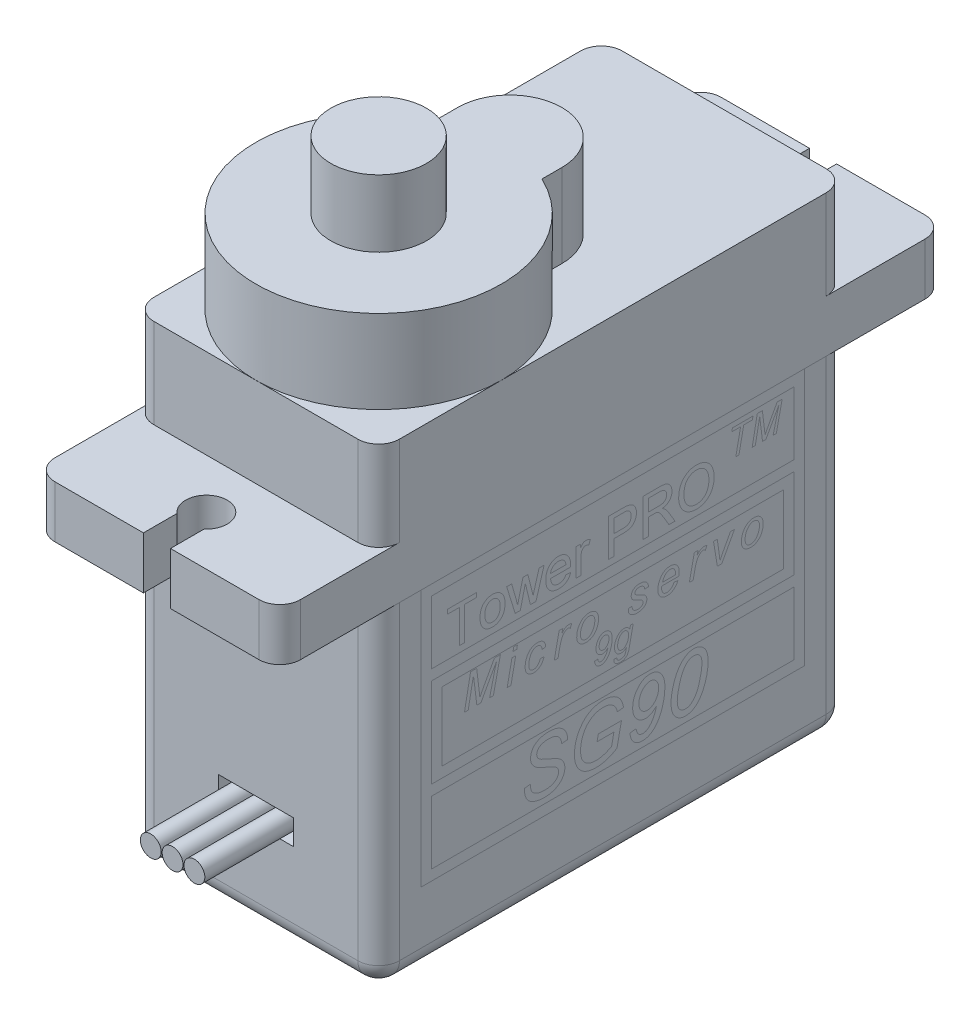
from build123d import *

# Parameters (mm, degrees)
EXTRUDE_1_DEPTH                = 5.9
EXTRUDE_2_DEPTH                = 4
SKETCH_3_R                     = 2.3
EXTRUDE_3_DEPTH                = 3.22
SKETCH_4_W                     = 3.6
SKETCH_4_H                     = 1.2
CUT_EXTRUDE_1_DEPTH            = 1
CUT_EXTRUDE_2_DEPTH            = 26.087247757
FILLET_1_R                     = 1
EXTRUDE_5_DEPTH                = 5
SPLIT_BODIES_1_SURFACE_1_BACK  = 46.37
SPLIT_BODIES_1_SURFACE_1_DEPTH = 92.74
SPLIT_BODIES_1_SURFACE_2_BACK  = 46.37
SPLIT_BODIES_1_SURFACE_2_DEPTH = 92.74
SKETCH_13_W                    = 18.412945036
SKETCH_13_H                    = 12.358306079
CUT_EXTRUDE_3_DEPTH            = 15
SPLIT_START                    = -11.25
SPLIT_BODIES_2_OUTLINE_R       = 0.5
SPLIT_BODIES_2_DEPTH           = 26.5
SPLIT_START_2                  = 9.206472518
SPLIT_BODIES_2_2_OUTLINE_W     = 11.8
SPLIT_BODIES_2_2_OUTLINE_H     = 12.358306079
SPLIT_BODIES_2_2_OUTLINE_R     = 0.5
SPLIT_BODIES_2_2_DEPTH         = 6.043527482
SPLIT_BODIES_2_3_OUTLINE_W     = 11.8
SPLIT_BODIES_2_3_OUTLINE_H     = 12.358306079
SPLIT_BODIES_2_3_OUTLINE_R     = 0.5
SPLIT_BODIES_2_3_DEPTH         = 2.043527482
SPLIT_START_3                  = -10.25
SPLIT_BODIES_2_4_DEPTH         = 20.5
SPLIT_BODIES_2_5_OUTLINE_W     = 11.8
SPLIT_BODIES_2_5_OUTLINE_H     = 12.358306079
SPLIT_BODIES_2_5_DEPTH         = 1.043527482
SPLIT_BODIES_2_6_OUTLINE_W     = 11.8
SPLIT_BODIES_2_6_OUTLINE_H     = 12.358306079
SPLIT_BODIES_2_6_DEPTH         = 1.043527482
SPLIT_START_4                  = 10.25
SPLIT_BODIES_2_7_OUTLINE_R     = 0.5
SPLIT_BODIES_2_7_DEPTH         = 5
SPLIT_BODIES_2_8_OUTLINE_W     = 3.6
SPLIT_BODIES_2_8_OUTLINE_H     = 1.2
SPLIT_BODIES_2_8_DEPTH         = 2.043527482
SPLIT_START_5                  = -10.35
SPLIT_BODIES_2_9_DEPTH         = 14.9
SPLIT_START_6                  = -5.95
SPLIT_BODIES_2_10_OUTLINE_W    = 3.6
SPLIT_BODIES_2_10_OUTLINE_H    = 1
SPLIT_BODIES_2_10_DEPTH        = 10.5
SPLIT_BODIES_2_11_OUTLINE_W    = 3.6
SPLIT_BODIES_2_11_OUTLINE_H    = 1
SPLIT_BODIES_2_11_DEPTH        = 3.2
PATTERN_CIRCULAR_2_ANGLE       = 180


with BuildPart() as part:
    # Эскиз1 → Бобышка-Вытянуть1 (new, symmetric)
    with BuildSketch(Plane(origin=(0, 0, 0), x_dir=(0, 0, -1), z_dir=(1, 0, 0))):
        Polygon((11.25, -11.35), (-11.25, -11.35), (-11.25, 4.55), (-16, 4.55), (-16, 7.05), (-11.25, 7.05), (-11.25, 11.35), (11.25, 11.35), (11.25, 7.05), (16, 7.05), (16, 4.55), (11.25, 4.55), align=None)
    extrude(amount=EXTRUDE_1_DEPTH, both=True)

    # Эскиз2 → Бобышка-Вытянуть2 (add)
    with BuildSketch(Plane(origin=(0, 11.35, 0), x_dir=(1, 0, 0), z_dir=(0, 1, 0))):
        with BuildLine():
            Line((-2.5, -0.005844314), (-2.5, 0.95))
            ThreePointArc((-2.5, 0.95), (0, 3.45), (2.5, 0.95))
            Line((2.5, 0.95), (2.5, -0.005844314))
            ThreePointArc((2.5, -0.005844314), (0, -11.25), (-2.5, -0.005844314))
        make_face()
    extrude(amount=EXTRUDE_2_DEPTH)

    # Эскиз3 → Бобышка-Вытянуть3 (add)
    with BuildSketch(Plane(origin=(0, 15.35, 0), x_dir=(1, 0, 0), z_dir=(0, 1, 0))):
        with Locations(Location((0, -5.35, 0), (0, 0, 90))):
            Circle(SKETCH_3_R)
    extrude(amount=EXTRUDE_3_DEPTH)

    # Эскиз4 → Вырез-Вытянуть1 (cut)
    with BuildSketch(Plane.XY.offset(11.25)):
        with Locations((0, -6.55)):
            Rectangle(SKETCH_4_W, SKETCH_4_H)
    extrude(amount=-CUT_EXTRUDE_1_DEPTH, mode=Mode.SUBTRACT)

    # Эскиз5 → Вырез-Вытянуть2 (cut, through all)
    with BuildSketch(Plane(origin=(0, 7.05, 0), x_dir=(1, 0, 0), z_dir=(0, 1, 0))):
        with BuildLine():
            Line((-0.65, -16), (0.65, -16))
            Line((0.65, -16), (0.65, -14.384934208))
            ThreePointArc((0.65, -14.384934208), (0, -12.625), (-0.65, -14.384934208))
            Line((-0.65, -14.384934208), (-0.65, -16))
        make_face()
        with BuildLine():
            Line((-0.65, 16), (-0.65, 14.384934208))
            ThreePointArc((-0.65, 14.384934208), (0, 12.625), (0.65, 14.384934208))
            Line((0.65, 14.384934208), (0.65, 16))
            Line((0.65, 16), (-0.65, 16))
        make_face()
    extrude(amount=-CUT_EXTRUDE_2_DEPTH, mode=Mode.SUBTRACT)

    # Скругление1
    fillet_1_edges = [part.edges().sort_by_distance(p)[0] for p in [
        (-5.9, 9.2, -11.25),
        (5.9, 5.8, 16),
        (-5.9, 5.8, -16),
        (-5.9, -3.4, -11.25),
        (-5.9, -11.35, 0),
        (-5.9, -3.4, 11.25),
        (-5.9, 5.8, 16),
        (-5.9, 9.2, 11.25),
        (5.9, -3.4, 11.25),
        (0, -11.35, -11.25),
        (0, -11.35, 11.25),
        (5.9, -11.35, 0),
        (5.9, -3.4, -11.25),
        (5.9, 5.8, -16),
        (5.9, 9.2, -11.25),
        (5.9, 9.2, 11.25),
    ]]
    fillet(fillet_1_edges, radius=FILLET_1_R)

    # Эскиз7 → Бобышка-Вытянуть5 (add)
    with BuildSketch(Plane.XY.offset(10.25)):
        with BuildLine():
            ThreePointArc((-1.55, -6.55), (-1.05, -7.05), (-0.55, -6.55))
            Line((-0.55, -6.55), (-1.55, -6.55))
        make_face()
        with BuildLine():
            Line((-1.55, -6.55), (-0.55, -6.55))
            ThreePointArc((-0.55, -6.55), (-1.05, -6.05), (-1.55, -6.55))
        make_face()
        with BuildLine():
            ThreePointArc((-0.5, -6.55), (0, -7.05), (0.5, -6.55))
            Line((0.5, -6.55), (-0.5, -6.55))
        make_face()
        with BuildLine():
            Line((-0.5, -6.55), (0.5, -6.55))
            ThreePointArc((0.5, -6.55), (0, -6.05), (-0.5, -6.55))
        make_face()
        with BuildLine():
            ThreePointArc((0.55, -6.55), (1.05, -7.05), (1.55, -6.55))
            Line((1.55, -6.55), (0.55, -6.55))
        make_face()
        with BuildLine():
            Line((0.55, -6.55), (1.55, -6.55))
            ThreePointArc((1.55, -6.55), (1.05, -6.05), (0.55, -6.55))
        make_face()
    extrude(amount=EXTRUDE_5_DEPTH)


with BuildPart() as body_2:
    # Split Bodies 1: the piece behind the surface
    add(part.part)
    # Split Bodies 1 surface: a surface, the sketch's curves swept straight by 92.74 mm
    with BuildLine(Plane(origin=(0, 0, 0), x_dir=(0, 0, -1), z_dir=(1, 0, 0)).offset(-SPLIT_BODIES_1_SURFACE_1_BACK), mode=Mode.PRIVATE) as split_bodies_1_surface_1_path:
        Line((-15, 4.55), (19.075279201, 4.55))
    split_bodies_1_surface_1 = Shell.extrude(split_bodies_1_surface_1_path.wire(), (1 * SPLIT_BODIES_1_SURFACE_1_DEPTH, 0 * SPLIT_BODIES_1_SURFACE_1_DEPTH, 0 * SPLIT_BODIES_1_SURFACE_1_DEPTH))
    split(bisect_by=split_bodies_1_surface_1, keep=Keep.BOTTOM)

    # Эскиз13 → Вырез-Вытянуть3 (cut)
    with BuildSketch(Plane(origin=(0, 0, 0), x_dir=(0, 0, -1), z_dir=(1, 0, 0))):
        with Locations((0, -1.629153039)):
            Rectangle(SKETCH_13_W, SKETCH_13_H)
    extrude(amount=-CUT_EXTRUDE_3_DEPTH, mode=Mode.SUBTRACT)

    # Split Bodies 2: read off the stored shape, not the designer's step
    # Split Bodies 2 outline → Split Bodies 2 (cut)
    with BuildSketch(Plane.XY.offset(SPLIT_START)):
        with BuildLine():
            Line((5.9, -10.35), (5.9, -7.808306079))
            Line((5.9, -7.808306079), (-5.9, -7.808306079))
            Line((-5.9, -7.808306079), (-5.9, -10.35))
            ThreePointArc((-5.9, -10.35), (-5.607106781, -11.057106781), (-4.9, -11.35))
            Line((-4.9, -11.35), (4.9, -11.35))
            ThreePointArc((4.9, -11.35), (5.607106781, -11.057106781), (5.9, -10.35))
        make_face()
        with Locations((-1.05, -6.55)):
            Circle(SPLIT_BODIES_2_OUTLINE_R)
    extrude(amount=SPLIT_BODIES_2_DEPTH, mode=Mode.SUBTRACT)

    # Split Bodies 2 2 outline → Split Bodies 2 2 (cut)
    with BuildSketch(Plane.XY.offset(SPLIT_START_2)):
        with Locations((0, -1.629153039)):
            Rectangle(SPLIT_BODIES_2_2_OUTLINE_W, SPLIT_BODIES_2_2_OUTLINE_H)
        with Locations((-1.05, -6.55)):
            Circle(SPLIT_BODIES_2_2_OUTLINE_R, mode=Mode.SUBTRACT)
    extrude(amount=SPLIT_BODIES_2_2_DEPTH, mode=Mode.SUBTRACT)

    # Split Bodies 2 3 outline → Split Bodies 2 3 (cut)
    with BuildSketch(Plane.XY.offset(SPLIT_START)):
        with Locations((0, -1.629153039)):
            Rectangle(SPLIT_BODIES_2_3_OUTLINE_W, SPLIT_BODIES_2_3_OUTLINE_H)
        with Locations((-1.05, -6.55)):
            Circle(SPLIT_BODIES_2_3_OUTLINE_R, mode=Mode.SUBTRACT)
    extrude(amount=SPLIT_BODIES_2_3_DEPTH, mode=Mode.SUBTRACT)


with BuildPart() as part_1:
    add(part.part)

    # Split Bodies 1: split by a surface, the side it looks to stays
    # Split Bodies 1 surface: a surface, the sketch's curves swept straight by 92.74 mm
    with BuildLine(Plane(origin=(0, 0, 0), x_dir=(0, 0, -1), z_dir=(1, 0, 0)).offset(-SPLIT_BODIES_1_SURFACE_2_BACK), mode=Mode.PRIVATE) as split_bodies_1_surface_2_path:
        Line((-15, 4.55), (19.075279201, 4.55))
    split_bodies_1_surface_2 = Shell.extrude(split_bodies_1_surface_2_path.wire(), (1 * SPLIT_BODIES_1_SURFACE_2_DEPTH, 0 * SPLIT_BODIES_1_SURFACE_2_DEPTH, 0 * SPLIT_BODIES_1_SURFACE_2_DEPTH))
    split(bisect_by=split_bodies_1_surface_2, keep=Keep.TOP)


with BuildPart() as body_3:
    # Split Bodies 2 4 outline → Split Bodies 2 4 (new body)
    with BuildSketch(Plane.XY.offset(SPLIT_START_3)):
        with BuildLine():
            Line((5.9, -7.808306079), (-5.9, -7.808306079))
            Line((-5.9, -7.808306079), (-5.9, -10.35))
            ThreePointArc((-5.9, -10.35), (-5.607106781, -11.057106781), (-4.9, -11.35))
            Line((-4.9, -11.35), (4.9, -11.35))
            ThreePointArc((4.9, -11.35), (5.607106781, -11.057106781), (5.9, -10.35))
            Line((5.9, -10.35), (5.9, -7.808306079))
        make_face()
    extrude(amount=SPLIT_BODIES_2_4_DEPTH)

    # Split Bodies 2 5 outline → Split Bodies 2 5 (add)
    with BuildSketch(Plane.XY.offset(SPLIT_START_3)):
        with Locations((0, -1.629153039)):
            Rectangle(SPLIT_BODIES_2_5_OUTLINE_W, SPLIT_BODIES_2_5_OUTLINE_H)
    extrude(amount=SPLIT_BODIES_2_5_DEPTH)

    # Split Bodies 2 6 outline → Split Bodies 2 6 (add)
    with BuildSketch(Plane.XY.offset(SPLIT_START_2)):
        with Locations((0, -1.629153039)):
            Rectangle(SPLIT_BODIES_2_6_OUTLINE_W, SPLIT_BODIES_2_6_OUTLINE_H)
    extrude(amount=SPLIT_BODIES_2_6_DEPTH)

    # Split Bodies 2 7 outline → Split Bodies 2 7 (add)
    with BuildSketch(Plane.XY.offset(SPLIT_START_4)):
        with Locations((-1.05, -6.55)):
            Circle(SPLIT_BODIES_2_7_OUTLINE_R)
        with Locations((0, -6.55)):
            Circle(SPLIT_BODIES_2_7_OUTLINE_R)
        with Locations((1.05, -6.55)):
            Circle(SPLIT_BODIES_2_7_OUTLINE_R)
    extrude(amount=SPLIT_BODIES_2_7_DEPTH)

    # Split Bodies 2 8 outline → Split Bodies 2 8 (add)
    with BuildSketch(Plane.XY.offset(SPLIT_START)):
        with Locations((0, -6.55)):
            Rectangle(SPLIT_BODIES_2_8_OUTLINE_W, SPLIT_BODIES_2_8_OUTLINE_H)
    extrude(amount=SPLIT_BODIES_2_8_DEPTH)

    # Split Bodies 2 9 outline → Split Bodies 2 9 (add)
    with BuildSketch(Plane(origin=(0, 0, 0), x_dir=(1, 0, 0), z_dir=(0, 1, 0)).offset(SPLIT_START_5)):
        with BuildLine():
            Line((1.8, -11.25), (4.9, -11.25))
            ThreePointArc((4.9, -11.25), (5.607106781, -10.957106781), (5.9, -10.25))
            Line((5.9, -10.25), (1.8, -10.25))
            Line((1.8, -10.25), (1.8, -11.25))
        make_face()
        with BuildLine():
            Line((-4.9, -11.25), (-1.8, -11.25))
            Line((-1.8, -11.25), (-1.8, -10.25))
            Line((-1.8, -10.25), (-5.9, -10.25))
            ThreePointArc((-5.9, -10.25), (-5.607106781, -10.957106781), (-4.9, -11.25))
        make_face()
        with BuildLine():
            ThreePointArc((-4.9, 11.25), (-5.607106781, 10.957106781), (-5.9, 10.25))
            Line((-5.9, 10.25), (5.9, 10.25))
            ThreePointArc((5.9, 10.25), (5.607106781, 10.957106781), (4.9, 11.25))
            Line((4.9, 11.25), (-4.9, 11.25))
        make_face()
    extrude(amount=SPLIT_BODIES_2_9_DEPTH)

    # Split Bodies 2 10 outline → Split Bodies 2 10 (add)
    with BuildSketch(Plane(origin=(0, 0, 0), x_dir=(1, 0, 0), z_dir=(0, 1, 0)).offset(SPLIT_START_6)):
        with Locations((0, -10.75)):
            Rectangle(SPLIT_BODIES_2_10_OUTLINE_W, SPLIT_BODIES_2_10_OUTLINE_H)
    extrude(amount=SPLIT_BODIES_2_10_DEPTH)

    # Split Bodies 2 11 outline → Split Bodies 2 11 (add)
    with BuildSketch(Plane(origin=(0, 0, 0), x_dir=(1, 0, 0), z_dir=(0, 1, 0)).offset(SPLIT_START_5)):
        with Locations((0, -10.75)):
            Rectangle(SPLIT_BODIES_2_11_OUTLINE_W, SPLIT_BODIES_2_11_OUTLINE_H)
    extrude(amount=SPLIT_BODIES_2_11_DEPTH)

    # Split Bodies 2 12 outline → Split Bodies 2 12 (revolve)
    with BuildSketch(Plane(origin=(0, -10.35, 10.25), x_dir=(0, 1, 0), z_dir=(0, 0, -1))):
        with BuildLine():
            Line((1, -4.9), (1, 4.9))
            ThreePointArc((1, 4.9), (0.707106781, 5.607106781), (0, 5.9))
            Line((0, 5.9), (0, -5.9))
            ThreePointArc((0, -5.9), (0.707106781, -5.607106781), (1, -4.9))
        make_face()
    revolve(axis=Axis((0, -10.35, 10.25), (1, 0, 0)))

    # Split Bodies 2 13 outline → Split Bodies 2 13 (revolve)
    with BuildSketch(Plane(origin=(0, -10.35, -10.25), x_dir=(0, 1, 0), z_dir=(0, 0, -1))):
        with BuildLine():
            Line((1, -4.9), (1, 4.9))
            ThreePointArc((1, 4.9), (0.707106781, 5.607106781), (0, 5.9))
            Line((0, 5.9), (0, -5.9))
            ThreePointArc((0, -5.9), (0.707106781, -5.607106781), (1, -4.9))
        make_face()
    revolve(axis=Axis((0, -10.35, -10.25), (1, 0, 0)))


with BuildPart() as body_4:
    # Круговой массив2: read off the stored shape, not the designer's step
    # Круговой массив2: copy of body 2
    add(body_2.part.rotate(Axis((0, 0, 0), (0, 1, 0)), PATTERN_CIRCULAR_2_ANGLE))


solid = Compound([body_2.part, part_1.part, body_3.part, body_4.part])
